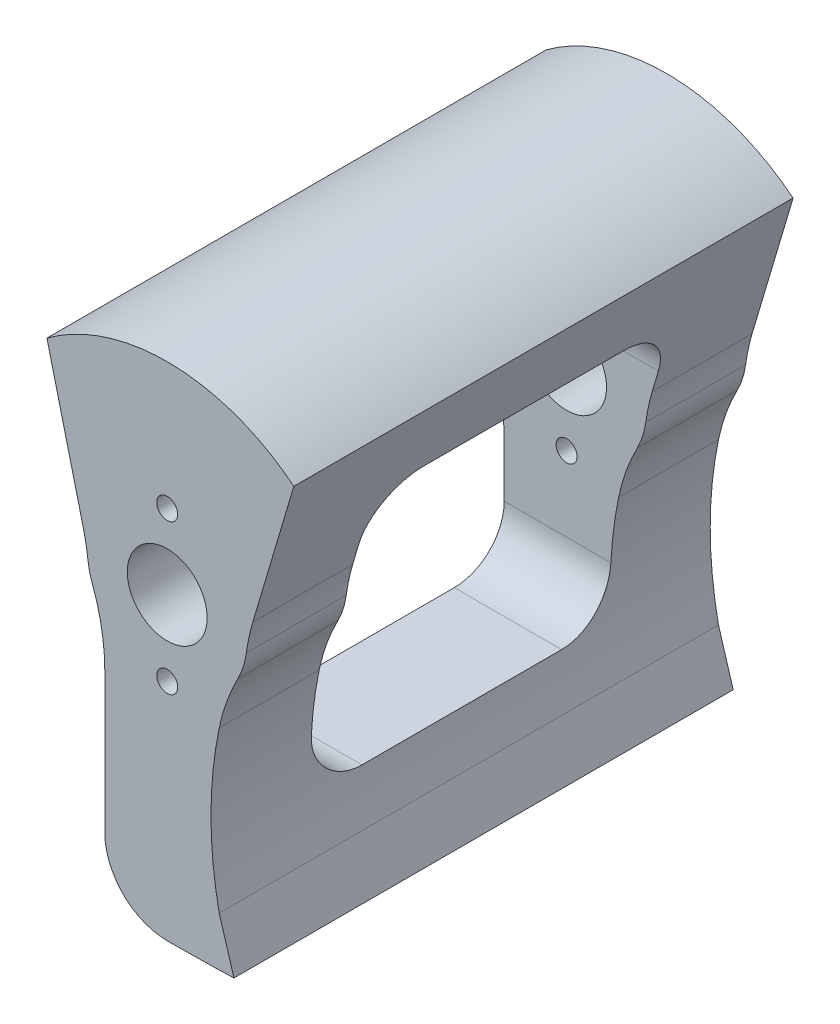
from build123d import *

# Parameters (mm, degrees)
BOSS_EXTRUDE1_DEPTH     = 50
FILLET1_R               = 12.5
FILLET2_R               = 40
CUT_EXTRUDE1_DEPTH      = 80.72452587
CUT_EXTRUDE1_DEPTH_BACK = 80.72452587
SKETCH7_W               = 60
SKETCH7_H               = 40
FILLET3_R               = 10
BOSS_EXTRUDE2_DEPTH     = 50
FILLET5_R               = 40
CUT_EXTRUDE2_DEPTH      = 83.117686393
CUT_EXTRUDE2_DEPTH_BACK = 83.117686393
SKETCH9_W               = 60
SKETCH9_H               = 18
FILLET4_R               = 10
CUT_EXTRUDE3_DEPTH      = 120.345357801
CUT_EXTRUDE3_DEPTH_BACK = 120.345357801
SKETCH10_R              = 2.1


with BuildPart() as part:
    # Sketch4 → Boss-Extrude1 (new, symmetric)
    with BuildSketch(Plane.XY):
        with BuildLine():
            ThreePointArc((8, 0), (0, -8), (-8, 0))
            Line((-8, 0), (-16, 0))
            ThreePointArc((-16, 0), (-15.099668871, -5.291502622), (-12.5, -9.987492178))
            Line((-12.5, -9.987492178), (-12.5, -58.683472972))
            ThreePointArc((-12.5, -58.683472972), (-6.284569266, -59.669960526), (0, -60))
            ThreePointArc((0, -60), (6.682717176, -59.945089422), (13.363629715, -59.780372517))
            Line((13.363629715, -59.780372517), (10.416666667, -50))
            ThreePointArc((10.416666667, -50), (8.869060232, -29.858930271), (12.5, -9.987492178))
            ThreePointArc((12.5, -9.987492178), (15.099668871, -5.291502622), (16, 0))
            Line((16, 0), (8, 0))
        make_face()
    extrude(amount=BOSS_EXTRUDE1_DEPTH, both=True)

    # Fillet1
    fillet1_edges = [part.edges().sort_by_distance(p)[0] for p in [
        (-12.5, -58.683472972, 0),
    ]]
    fillet(fillet1_edges, radius=FILLET1_R - 0.0001)  # a hair under: the kernel refuses the full size

    # Fillet2
    fillet2_edges = [part.edges().sort_by_distance(p)[0] for p in [
        (-12.5, -9.987492178, 0),
        (12.5, -9.987492178, 0),
    ]]
    fillet(fillet2_edges, radius=FILLET2_R)

    # Sketch7 → Cut-Extrude1 (cut, two sides: drawn at the far end of the back side and taken through both)
    with BuildSketch(Plane(origin=(0, 0, 0), x_dir=(0, 0, -1), z_dir=(1, 0, 0)).offset(-CUT_EXTRUDE1_DEPTH_BACK)):
        with Locations((0, -20)):
            Rectangle(SKETCH7_W, SKETCH7_H)
    extrude(amount=CUT_EXTRUDE1_DEPTH + CUT_EXTRUDE1_DEPTH_BACK, mode=Mode.SUBTRACT)

    # Fillet3
    fillet3_edges = [part.edges().sort_by_distance(p)[0] for p in [
        (-1.752259827, -40, -30),
        (-1.752259827, -40, 30),
    ]]
    fillet(fillet3_edges, radius=FILLET3_R)

    # Sketch8 → Boss-Extrude2 (add, symmetric)
    with BuildSketch(Plane.XY):
        with BuildLine():
            Line((8, 0), (16, 0))
            ThreePointArc((16, 0), (0, 16), (-16, 0))
            Line((-16, 0), (-8, 0))
            ThreePointArc((-8, 0), (0, 8), (8, 0))
        make_face()
        with BuildLine():
            ThreePointArc((-16, 0), (0, 16), (16, 0))
            Line((16, 0), (16, 37.1510767))
            ThreePointArc((16, 37.1510767), (-4.673406093, 40.179121139), (-24.099890471, 32.486886266))
            Line((-24.099890471, 32.486886266), (-16, 0))
        make_face()
        with BuildLine():
            Line((16, 37.1510767), (16, 0))
            Line((16, 0), (25.363643105, 31.510127078))
            ThreePointArc((25.363643105, 31.510127078), (20.873256116, 34.648371955), (16, 37.1510767))
        make_face()
    extrude(amount=BOSS_EXTRUDE2_DEPTH, both=True)

    # Fillet5
    fillet5_edges = [part.edges().sort_by_distance(p)[0] for p in [
        (-16, 0, 40),
        (16, 0, 40),
        (-16, 0, -40),
        (16, 0, -40),
    ]]
    fillet(fillet5_edges, radius=FILLET5_R)

    # Sketch9 → Cut-Extrude2 (cut, two sides: drawn at the far end of the back side and taken through both)
    with BuildSketch(Plane(origin=(0, 0, 0), x_dir=(0, 0, -1), z_dir=(1, 0, 0)).offset(-CUT_EXTRUDE2_DEPTH_BACK)):
        with Locations((0, 9)):
            Rectangle(SKETCH9_W, SKETCH9_H)
    extrude(amount=CUT_EXTRUDE2_DEPTH + CUT_EXTRUDE2_DEPTH_BACK, mode=Mode.SUBTRACT)

    # Fillet4
    fillet4_edges = [part.edges().sort_by_distance(p)[0] for p in [
        (0.430514749, 18, 30),
        (0.430514749, 18, -30),
    ]]
    fillet(fillet4_edges, radius=FILLET4_R - 0.0001)  # a hair under: the kernel refuses the full size

    # Sketch10 → Cut-Extrude3 (cut, two sides: drawn at the far end of the back side and taken through both)
    with BuildSketch(Plane.XY.offset(50).offset(-CUT_EXTRUDE3_DEPTH_BACK)):
        with Locations((0, 15)):
            Circle(SKETCH10_R)
        with Locations((0, -15)):
            Circle(SKETCH10_R)
    extrude(amount=CUT_EXTRUDE3_DEPTH + CUT_EXTRUDE3_DEPTH_BACK, mode=Mode.SUBTRACT)


solid = part.part
